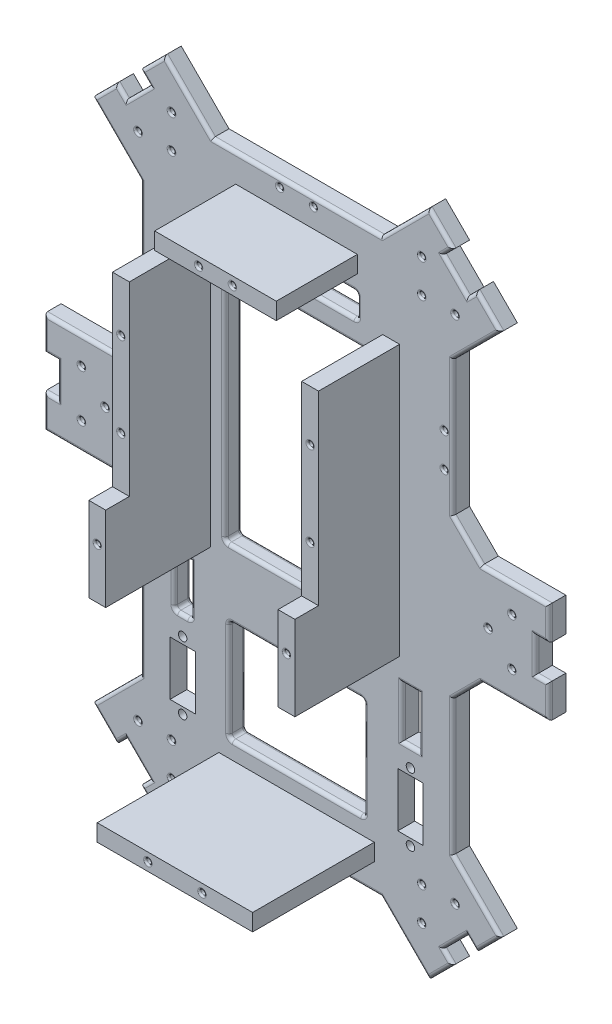
from build123d import *

# Parameters (mm, degrees)
DODANIE_WYCI_GNI_CIE1_DEPTH     = 5
WYTNIJ_WYCI_GNI_CIE7_DEPTH      = 42
WYTNIJ_WYCI_GNI_CIE7_DEPTH_BACK = 60
SZKIC11_R                       = 0.8
WYTNIJ_WYCI_GNI_CIE8_DEPTH      = 36
WYTNIJ_WYCI_GNI_CIE8_DEPTH_BACK = 66
SZKIC12_R                       = 0.75
WYTNIJ_WYCI_GNI_CIE9_DEPTH      = 54
WYTNIJ_WYCI_GNI_CIE9_DEPTH_BACK = 47
SZKIC13_R                       = 1.25
SZKIC13_W                       = 42.426406872
SZKIC13_H                       = 70
SZKIC13_W_2                     = 40
SZKIC13_H_2                     = 30
SZKIC13_W_3                     = 5
SZKIC13_H_3                     = 15
SZKIC13_W_4                     = 7.5
SZKIC13_H_4                     = 16
SZKIC13_W_5                     = 36
SZKIC13_H_5                     = 7
SZKIC14_W                       = 5
SZKIC14_H                       = 80
SZKIC14_R                       = 0.75
SZKIC14_W_2                     = 46
SZKIC14_H_2                     = 5
SZKIC14_W_3                     = 36
DODANIE_WYCI_GNI_CIE7_DEPTH     = 24
SZKIC14_9_W                     = 46
SZKIC14_9_H                     = 5
SZKIC14_9_R                     = 0.75
DODANIE_WYCI_GNI_CIE8_DEPTH     = 36
SZKIC17_W                       = 5
SZKIC17_H                       = 25
SZKIC17_R                       = 0.75
DODANIE_WYCI_GNI_CIE9_DEPTH     = 36
ZAOKR_GLENIE3_R                 = 1
ZAOKR_GLENIE4_R                 = 1
ZAOKR_GLENIE5_R                 = 0.5


with BuildPart() as part:
    # Szkic1 → Dodanie-wyciągnięcie1 (new body)
    with BuildSketch(Plane.XY):
        Polygon((0, 0), (-50, 0), (-64.142135624, 14.142135624), (-71.213203436, 7.071067812), (-68.384776311, 4.242640687), (-75.455844123, -2.828427125), (-78.284271247, 0), (-85.355339059, -7.071067812), (-71.213203436, -21.213203436), (-71.213203436, -61.213203436), (-79.69848481, -69.69848481), (-99.69848481, -69.69848481), (-99.69848481, -79.69848481), (-95.69848481, -79.69848481), (-95.69848481, -89.69848481), (-99.69848481, -89.69848481), (-99.69848481, -99.69848481), (-79.69848481, -99.69848481), (-71.213203436, -108.183766184), (-71.213203436, -148.183766184), (-85.355339059, -162.325901808), (-78.284271247, -169.39696962), (-75.455844123, -166.568542495), (-68.384776311, -173.639610307), (-71.213203436, -176.468037432), (-64.142135624, -183.539105243), (-50, -169.39696962), (0, -169.39696962), (14.142135624, -183.539105243), (21.213203436, -176.468037432), (18.384776311, -173.639610307), (25.455844123, -166.568542495), (28.284271247, -169.39696962), (35.355339059, -162.325901808), (21.213203436, -148.183766184), (21.213203436, -108.183766184), (29.69848481, -99.69848481), (49.69848481, -99.69848481), (49.69848481, -89.69848481), (45.69848481, -89.69848481), (45.69848481, -79.69848481), (49.69848481, -79.69848481), (49.69848481, -69.69848481), (29.69848481, -69.69848481), (21.213203436, -61.213203436), (21.213203436, -21.213203436), (35.355339059, -7.071067812), (28.284271247, 0), (25.455844123, -2.828427125), (18.384776311, 4.242640687), (21.213203436, 7.071067812), (14.142135624, 14.142135624), align=None)
    extrude(amount=DODANIE_WYCI_GNI_CIE1_DEPTH)

    # Szkic11 → Wytnij-wyciągnięcie7 (cut, two sides: drawn at the far end of the back side and taken through both)
    with BuildSketch(Plane.XY.offset(5).offset(-WYTNIJ_WYCI_GNI_CIE7_DEPTH_BACK)):
        with Locations((-81.69848481, -84.69848481)):
            Circle(SZKIC11_R)
        with Locations((-88.69848481, -77.69848481)):
            Circle(SZKIC11_R)
        with Locations((-88.69848481, -91.69848481)):
            Circle(SZKIC11_R)
        with Locations((-62.02081528, -9.192388155)):
            Circle(SZKIC11_R)
        with Locations((-62.02081528, 0.707106781)):
            Circle(SZKIC11_R)
        with Locations((-71.920310217, -9.192388155)):
            Circle(SZKIC11_R)
        with Locations((12.02081528, -9.192388155)):
            Circle(SZKIC11_R)
        with Locations((12.02081528, 0.707106781)):
            Circle(SZKIC11_R)
        with Locations((21.920310217, -9.192388155)):
            Circle(SZKIC11_R)
        with Locations((31.69848481, -84.69848481)):
            Circle(SZKIC11_R)
        with Locations((38.69848481, -77.69848481)):
            Circle(SZKIC11_R)
        with Locations((38.69848481, -91.69848481)):
            Circle(SZKIC11_R)
        with Locations((12.02081528, -160.204581464)):
            Circle(SZKIC11_R)
        with Locations((21.920310217, -160.204581464)):
            Circle(SZKIC11_R)
        with Locations((12.02081528, -170.104076401)):
            Circle(SZKIC11_R)
        with Locations((-62.02081528, -160.204581464)):
            Circle(SZKIC11_R)
        with Locations((-71.920310217, -160.204581464)):
            Circle(SZKIC11_R)
        with Locations((-62.02081528, -170.104076401)):
            Circle(SZKIC11_R)
    extrude(amount=WYTNIJ_WYCI_GNI_CIE7_DEPTH + WYTNIJ_WYCI_GNI_CIE7_DEPTH_BACK, mode=Mode.SUBTRACT)

    # Szkic12 → Wytnij-wyciągnięcie8 (cut, two sides: drawn at the far end of the back side and taken through both)
    with BuildSketch(Plane.XY.offset(5).offset(-WYTNIJ_WYCI_GNI_CIE8_DEPTH_BACK)):
        with Locations((-30, -2.5)):
            Circle(SZKIC12_R)
        with Locations((-20, -2.5)):
            Circle(SZKIC12_R)
        with Locations((-30, -166.89696962)):
            Circle(SZKIC12_R)
        with Locations((-20, -166.89696962)):
            Circle(SZKIC12_R)
        with Locations((-68.713203436, -40.5)):
            Circle(SZKIC12_R)
        with Locations((-68.713203436, -50.5)):
            Circle(SZKIC12_R)
        with Locations((18.713203436, -40.5)):
            Circle(SZKIC12_R)
        with Locations((18.713203436, -50.5)):
            Circle(SZKIC12_R)
    extrude(amount=WYTNIJ_WYCI_GNI_CIE8_DEPTH + WYTNIJ_WYCI_GNI_CIE8_DEPTH_BACK, mode=Mode.SUBTRACT)

    # Szkic13 → Wytnij-wyciągnięcie9 (cut, two sides: drawn at the far end of the back side and taken through both)
    with BuildSketch(Plane.XY.offset(-WYTNIJ_WYCI_GNI_CIE9_DEPTH_BACK)):
        with Locations((8.713203436, -132)):
            Circle(SZKIC13_R)
        with Locations((8.713203436, -152)):
            Circle(SZKIC13_R)
        with Locations((-58.713203436, -132)):
            Circle(SZKIC13_R)
        with Locations((-58.713203436, -152)):
            Circle(SZKIC13_R)
        with Locations((-25, -66.5)):
            Rectangle(SZKIC13_W, SZKIC13_H)
        with Locations((-25.003203436, -136.39696962)):
            Rectangle(SZKIC13_W_2, SZKIC13_H_2)
        with Locations((-58.713203436, -119)):
            Rectangle(SZKIC13_W_3, SZKIC13_H_3)
        with Locations((-58.713203436, -142)):
            Rectangle(SZKIC13_W_4, SZKIC13_H_4)
        with Locations((8.713203436, -142)):
            Rectangle(SZKIC13_W_4, SZKIC13_H_4)
        with Locations((-25.003203436, -21.5)):
            Rectangle(SZKIC13_W_5, SZKIC13_H_5)
        with Locations((8.713203436, -119)):
            Rectangle(SZKIC13_W_3, SZKIC13_H_3)
    extrude(amount=WYTNIJ_WYCI_GNI_CIE9_DEPTH + WYTNIJ_WYCI_GNI_CIE9_DEPTH_BACK, mode=Mode.SUBTRACT)

    # Szkic14 → Dodanie-wyciągnięcie7 (add)
    # profile 1 of 4: a face of its own
    with BuildSketch(Plane.XY.offset(5)):
        with Locations((-52.998203436, -65)):
            Rectangle(SZKIC14_W, SZKIC14_H)
        with Locations((-52.998203436, -40)):
            Circle(SZKIC14_R, mode=Mode.SUBTRACT)
        with Locations((-52.998203436, -65)):
            Circle(SZKIC14_R, mode=Mode.SUBTRACT)
        with Locations((-52.998203436, -90)):
            Circle(SZKIC14_R, mode=Mode.SUBTRACT)
    # profile 2 of 4: a face of its own
    with BuildSketch(Plane.XY.offset(5)):
        with Locations((3.001796564, -65)):
            Rectangle(SZKIC14_W, SZKIC14_H)
        with Locations((3.001796564, -40)):
            Circle(SZKIC14_R, mode=Mode.SUBTRACT)
        with Locations((3.001796564, -65)):
            Circle(SZKIC14_R, mode=Mode.SUBTRACT)
        with Locations((3.001796564, -90)):
            Circle(SZKIC14_R, mode=Mode.SUBTRACT)
    # profile 3 of 4: a face of its own
    with BuildSketch(Plane.XY.offset(5)):
        with Locations((-25.003203436, -158.89696962)):
            Rectangle(SZKIC14_W_2, SZKIC14_H_2)
        with Locations((-33.003203436, -158.89696962)):
            Circle(SZKIC14_R, mode=Mode.SUBTRACT)
        with Locations((-17.003203436, -158.89696962)):
            Circle(SZKIC14_R, mode=Mode.SUBTRACT)
    # profile 4 of 4: a face of its own
    with BuildSketch(Plane.XY.offset(5)):
        with Locations((-25.003203436, -10.69696962)):
            Rectangle(SZKIC14_W_3, SZKIC14_H_2)
        with Locations((-30.003203436, -10.69696962)):
            Circle(SZKIC14_R, mode=Mode.SUBTRACT)
        with Locations((-20.003203436, -10.69696962)):
            Circle(SZKIC14_R, mode=Mode.SUBTRACT)
    extrude(amount=DODANIE_WYCI_GNI_CIE7_DEPTH)

    # Szkic14<9> → Dodanie-wyciągnięcie8 (add)
    with BuildSketch(Plane.XY.offset(5)):
        with Locations((-25.003203436, -158.89696962)):
            Rectangle(SZKIC14_9_W, SZKIC14_9_H)
        with Locations((-33.003203436, -158.89696962)):
            Circle(SZKIC14_9_R, mode=Mode.SUBTRACT)
        with Locations((-17.003203436, -158.89696962)):
            Circle(SZKIC14_9_R, mode=Mode.SUBTRACT)
    extrude(amount=DODANIE_WYCI_GNI_CIE8_DEPTH)

    # Szkic17 → Dodanie-wyciągnięcie9 (add)
    # profile 1 of 2: a face of its own
    with BuildSketch(Plane.XY):
        with Locations((-52.998203436, -92.5)):
            Rectangle(SZKIC17_W, SZKIC17_H)
        with Locations((-52.998203436, -90)):
            Circle(SZKIC17_R, mode=Mode.SUBTRACT)
    # profile 2 of 2: a face of its own
    with BuildSketch(Plane.XY):
        with Locations((3.001796564, -92.5)):
            Rectangle(SZKIC17_W, SZKIC17_H)
        with Locations((3.001796564, -90)):
            Circle(SZKIC17_R, mode=Mode.SUBTRACT)
    extrude(amount=DODANIE_WYCI_GNI_CIE9_DEPTH)

    # Zaokrąglenie3
    zaokr_glenie3_edges = [part.edges().sort_by_distance(p)[0] for p in [
        (-97.69848481, -79.69848481, 5),
        (-95.69848481, -84.69848481, 5),
        (-97.69848481, -89.69848481, 5),
        (-99.69848481, -94.69848481, 5),
        (-89.69848481, -99.69848481, 5),
        (-75.455844123, -103.941125497, 5),
        (-71.213203436, -128.183766184, 5),
        (-78.284271247, -155.254833996, 5),
        (-76.870057685, -167.982756057, 5),
        (-69.798989873, -175.053823869, 5),
        (-81.819805153, -165.861435714, 5),
        (-71.920310217, -170.104076401, 5),
        (-67.67766953, -180.003571337, 5),
        (-57.071067812, -176.468037432, 5),
        (-25, -169.39696962, 5),
        (7.071067812, -176.468037432, 5),
        (17.67766953, -180.003571337, 5),
        (19.798989873, -175.053823869, 5),
        (21.920310217, -170.104076401, 5),
        (26.870057685, -167.982756057, 5),
        (31.819805153, -165.861435714, 5),
        (28.284271247, -155.254833996, 5),
        (21.213203436, -128.183766184, 5),
        (25.455844123, -103.941125497, 5),
        (39.69848481, -99.69848481, 5),
        (49.69848481, -94.69848481, 5),
        (47.69848481, -89.69848481, 5),
        (45.69848481, -84.69848481, 5),
        (47.69848481, -79.69848481, 5),
        (49.69848481, -74.69848481, 5),
        (39.69848481, -69.69848481, 5),
        (25.455844123, -65.455844123, 5),
        (21.213203436, -41.213203436, 5),
        (28.284271247, -14.142135624, 5),
        (31.819805153, -3.535533906, 5),
        (26.870057685, -1.414213562, 5),
        (21.920310217, 0.707106781, 5),
        (19.798989873, 5.656854249, 5),
        (17.67766953, 10.606601718, 5),
        (7.071067812, 7.071067812, 5),
        (-25, 0, 5),
        (-69.798989873, 5.656854249, 5),
        (-67.67766953, 10.606601718, 5),
        (-57.071067812, 7.071067812, 5),
        (-71.920310217, 0.707106781, 5),
        (-76.870057685, -1.414213562, 5),
        (-81.819805153, -3.535533906, 5),
        (-78.284271247, -14.142135624, 5),
        (-71.213203436, -41.213203436, 5),
        (-75.455844123, -65.455844123, 5),
        (-89.69848481, -69.69848481, 5),
        (-99.69848481, -74.69848481, 5),
    ]]
    fillet(zaokr_glenie3_edges, radius=ZAOKR_GLENIE3_R)

    # Zaokrąglenie4
    zaokr_glenie4_edges = [part.edges().sort_by_distance(p)[0] for p in [
        (-56.213203436, -119, 5),
        (-61.213203436, -119, 5),
        (-61.213203436, -119, 0),
        (-56.213203436, -119, 0),
        (-45.003203436, -136.39696962, 5),
        (-5.003203436, -136.39696962, 5),
        (-5.003203436, -136.39696962, 0),
        (-45.003203436, -136.39696962, 0),
        (-46.213203436, -66.5, 5),
        (-3.786796564, -66.5, 5),
        (-3.786796564, -66.5, 0),
        (-46.213203436, -66.5, 0),
        (-7.003203436, -21.5, 5),
        (-43.003203436, -21.5, 5),
        (-43.003203436, -21.5, 0),
        (-7.003203436, -21.5, 0),
        (-58.713203436, -126.5, 5),
        (-61.213203436, -126.5, 2.5),
        (-58.713203436, -126.5, 0),
        (-56.213203436, -126.5, 2.5),
        (-25.003203436, -151.39696962, 5),
        (-45.003203436, -151.39696962, 2.5),
        (-25.003203436, -151.39696962, 0),
        (-5.003203436, -151.39696962, 2.5),
        (-25.003203436, -121.39696962, 5),
        (-5.003203436, -121.39696962, 2.5),
        (-25.003203436, -121.39696962, 0),
        (-45.003203436, -121.39696962, 2.5),
        (-25, -101.5, 5),
        (-46.213203436, -101.5, 2.5),
        (-25, -101.5, 0),
        (-3.786796564, -101.5, 2.5),
        (-25, -31.5, 5),
        (-3.786796564, -31.5, 2.5),
        (-25, -31.5, 0),
        (-46.213203436, -31.5, 2.5),
        (-25.003203436, -18, 5),
        (-7.003203436, -18, 2.5),
        (-25.003203436, -18, 0),
        (-43.003203436, -18, 2.5),
        (-25.003203436, -25, 5),
        (-43.003203436, -25, 2.5),
        (-25.003203436, -25, 0),
        (-7.003203436, -25, 2.5),
        (-58.713203436, -111.5, 0),
        (-58.713203436, -111.5, 5),
        (8.713203436, -126.5, 5),
        (11.213203436, -119, 5),
        (8.713203436, -111.5, 5),
        (6.213203436, -119, 5),
    ]]
    fillet(zaokr_glenie4_edges, radius=ZAOKR_GLENIE4_R)

    # Zaokrąglenie5
    zaokr_glenie5_edges = [part.edges().sort_by_distance(p)[0] for p in [
        (11.22081528, -170.104076401, 5),
        (11.22081528, -160.204581464, 5),
        (21.120310217, -160.204581464, 5),
        (-20.75, -166.89696962, 5),
        (-30.75, -166.89696962, 5),
        (-62.82081528, -170.104076401, 5),
        (-62.82081528, -160.204581464, 5),
        (-72.720310217, -160.204581464, 5),
        (-69.463203436, -50.5, 5),
        (-69.463203436, -40.5, 5),
        (37.89848481, -91.69848481, 5),
        (30.89848481, -84.69848481, 5),
        (37.89848481, -77.69848481, 5),
        (17.963203436, -50.5, 5),
        (17.963203436, -40.5, 5),
        (21.120310217, -9.192388155, 5),
        (11.22081528, -9.192388155, 5),
        (-30.75, -2.5, 5),
        (-20.75, -2.5, 5),
        (11.22081528, 0.707106781, 5),
        (-62.82081528, -9.192388155, 5),
        (-72.720310217, -9.192388155, 5),
        (-62.82081528, 0.707106781, 5),
        (-89.49848481, -91.69848481, 5),
        (-82.49848481, -84.69848481, 5),
        (-89.49848481, -77.69848481, 5),
        (-20.753203436, -10.69696962, 29),
        (-30.753203436, -10.69696962, 29),
        (-33.753203436, -158.89696962, 41),
        (-17.753203436, -158.89696962, 41),
        (2.251796564, -90, 36),
        (2.251796564, -65, 29),
        (2.251796564, -40, 29),
        (-53.748203436, -90, 36),
        (-53.748203436, -65, 29),
        (-53.748203436, -40, 29),
    ]]
    fillet(zaokr_glenie5_edges, radius=ZAOKR_GLENIE5_R)


solid = part.part
